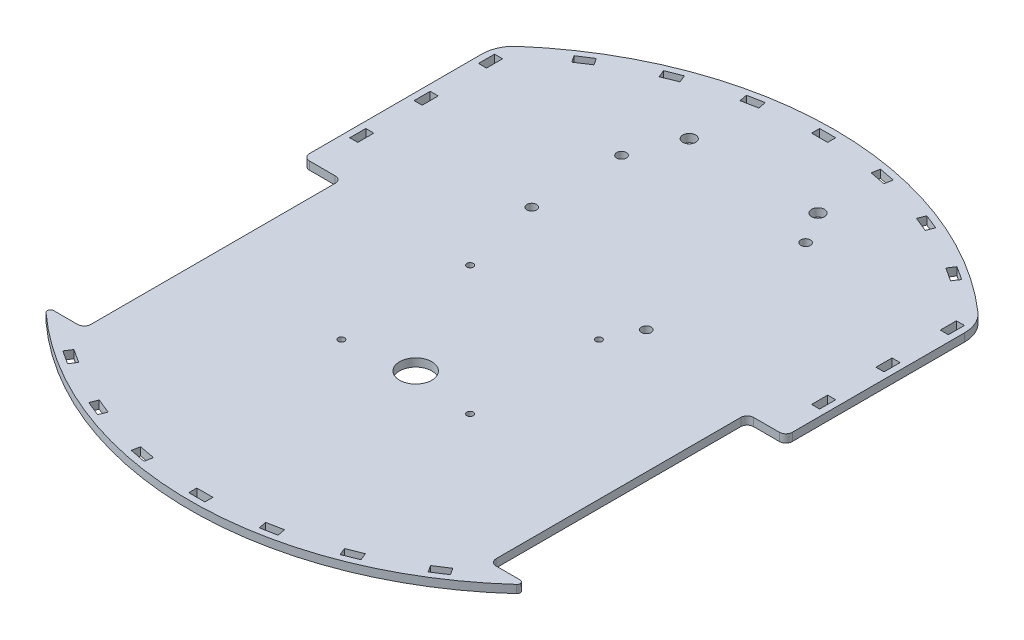
from build123d import *

# Parameters (mm, degrees)
SKETCH1_W           = 2.5
SKETCH1_H           = 5
SKETCH1_R           = 1
SKETCH1_R_2         = 1.5
SKETCH1_R_3         = 2
SKETCH1_W_2         = 5
SKETCH1_H_2         = 2.5
SKETCH1_R_4         = 5
BOSS_EXTRUDE1_DEPTH = 1.25
FILLET2_R           = 10
FILLET3_R           = 2
FILLET4_R           = 1


with BuildPart() as part:
    # Sketch1 → Boss-Extrude1 (new, symmetric)
    with BuildSketch(Plane(origin=(0, 0, 0), x_dir=(1, 0, 0), z_dir=(0, 1, 0))):
        with BuildLine():
            Line((-75, 70), (-75, 10))
            Line((-75, 10), (-63, 10))
            Line((-63, 10), (-63, -70))
            Line((-63, -70), (-75, -70))
            ThreePointArc((-75, -70), (0, -100), (75, -70))
            Line((75, -70), (63, -70))
            Line((63, -70), (63, 10))
            Line((63, 10), (75, 10))
            Line((75, 10), (75, 70))
            ThreePointArc((75, 70), (0, 100), (-75, 70))
        make_face()
        with Locations((-71.75, 25)):
            Rectangle(SKETCH1_W, SKETCH1_H, mode=Mode.SUBTRACT)
        with Locations((-71.75, 45)):
            Rectangle(SKETCH1_W, SKETCH1_H, mode=Mode.SUBTRACT)
        with Locations((-20, 6.9)):
            Circle(SKETCH1_R, mode=Mode.SUBTRACT)
        with Locations((-26.05, 32.1)):
            Circle(SKETCH1_R_2, mode=Mode.SUBTRACT)
        with Locations((-71.75, 65)):
            Rectangle(SKETCH1_W, SKETCH1_H, mode=Mode.SUBTRACT)
        Polygon((-56.025559667, 82.150765475), (-54.664376871, 80.053819745), (-58.858268331, 77.331454153), (-60.219451128, 79.428399883), align=None, mode=Mode.SUBTRACT)
        Polygon((-37.658117299, 91.168360182), (-36.721906516, 88.850277058), (-41.358072765, 86.977855492), (-42.294283547, 89.295938617), align=None, mode=Mode.SUBTRACT)
        with Locations((-26.05, 60)):
            Circle(SKETCH1_R_2, mode=Mode.SUBTRACT)
        with Locations((-20, 75)):
            Circle(SKETCH1_R_3, mode=Mode.SUBTRACT)
        Polygon((-17.907851034, 96.516905395), (-17.430990368, 94.062805986), (-22.339189184, 93.109084654), (-22.81604985, 95.563184062), align=None, mode=Mode.SUBTRACT)
        with Locations((0, 96.75)):
            Rectangle(SKETCH1_W_2, SKETCH1_H_2, mode=Mode.SUBTRACT)
        with Locations((20, 6.9)):
            Circle(SKETCH1_R, mode=Mode.SUBTRACT)
        with Locations((24.75, 16.9)):
            Circle(SKETCH1_R_2, mode=Mode.SUBTRACT)
        with Locations((71.75, 25)):
            Rectangle(SKETCH1_W, SKETCH1_H, mode=Mode.SUBTRACT)
        with Locations((71.75, 45)):
            Rectangle(SKETCH1_W, SKETCH1_H, mode=Mode.SUBTRACT)
        with Locations((26.05, 65.1)):
            Circle(SKETCH1_R_2, mode=Mode.SUBTRACT)
        with Locations((20, 75)):
            Circle(SKETCH1_R_3, mode=Mode.SUBTRACT)
        Polygon((22.339189184, 93.109084654), (17.430990368, 94.062805986), (17.907851034, 96.516905395), (22.81604985, 95.563184062), align=None, mode=Mode.SUBTRACT)
        with Locations((71.75, 65)):
            Rectangle(SKETCH1_W, SKETCH1_H, mode=Mode.SUBTRACT)
        Polygon((41.358072765, 86.977855492), (36.721906516, 88.850277058), (37.658117299, 91.168360182), (42.294283547, 89.295938617), align=None, mode=Mode.SUBTRACT)
        Polygon((58.858268331, 77.331454153), (54.664376871, 80.053819745), (56.025559667, 82.150765475), (60.219451128, 79.428399883), align=None, mode=Mode.SUBTRACT)
        with Locations((20, -33.1)):
            Circle(SKETCH1_R, mode=Mode.SUBTRACT)
        Polygon((-58.858268331, -77.331454153), (-54.664376871, -80.053819745), (-56.025559667, -82.150765475), (-60.219451128, -79.428399883), align=None, mode=Mode.SUBTRACT)
        Polygon((-41.358072765, -86.977855492), (-36.721906516, -88.850277058), (-37.658117299, -91.168360182), (-42.294283547, -89.295938617), align=None, mode=Mode.SUBTRACT)
        Polygon((-22.339189184, -93.109084654), (-17.430990368, -94.062805986), (-17.907851034, -96.516905395), (-22.81604985, -95.563184062), align=None, mode=Mode.SUBTRACT)
        with Locations((0, -96.75)):
            Rectangle(SKETCH1_W_2, SKETCH1_H_2, mode=Mode.SUBTRACT)
        with Locations((-20, -33.1)):
            Circle(SKETCH1_R, mode=Mode.SUBTRACT)
        Polygon((17.907851034, -96.516905395), (17.430990368, -94.062805986), (22.339189184, -93.109084654), (22.81604985, -95.563184062), align=None, mode=Mode.SUBTRACT)
        Polygon((37.658117299, -91.168360182), (36.721906516, -88.850277058), (41.358072765, -86.977855492), (42.294283547, -89.295938617), align=None, mode=Mode.SUBTRACT)
        Polygon((56.025559667, -82.150765475), (54.664376871, -80.053819745), (58.858268331, -77.331454153), (60.219451128, -79.428399883), align=None, mode=Mode.SUBTRACT)
        with Locations((0, -30)):
            Circle(SKETCH1_R_4, mode=Mode.SUBTRACT)
    extrude(amount=BOSS_EXTRUDE1_DEPTH, both=True)

    # Fillet2
    fillet2_edges = [part.edges().sort_by_distance(p)[0] for p in [
        (75, 0, -70),
        (-75, 0, -70),
    ]]
    fillet(fillet2_edges, radius=FILLET2_R)

    # Fillet3
    fillet3_edges = [part.edges().sort_by_distance(p)[0] for p in [
        (75, 0, -10),
        (63, 0, -10),
        (63, 0, 70),
        (-63, 0, 70),
        (-75, 0, -10),
        (-63, 0, -10),
    ]]
    fillet(fillet3_edges, radius=FILLET3_R)

    # Fillet4
    fillet4_edges = [part.edges().sort_by_distance(p)[0] for p in [
        (75, 0, 70),
        (-75, 0, 70),
    ]]
    fillet(fillet4_edges, radius=FILLET4_R)


solid = part.part
